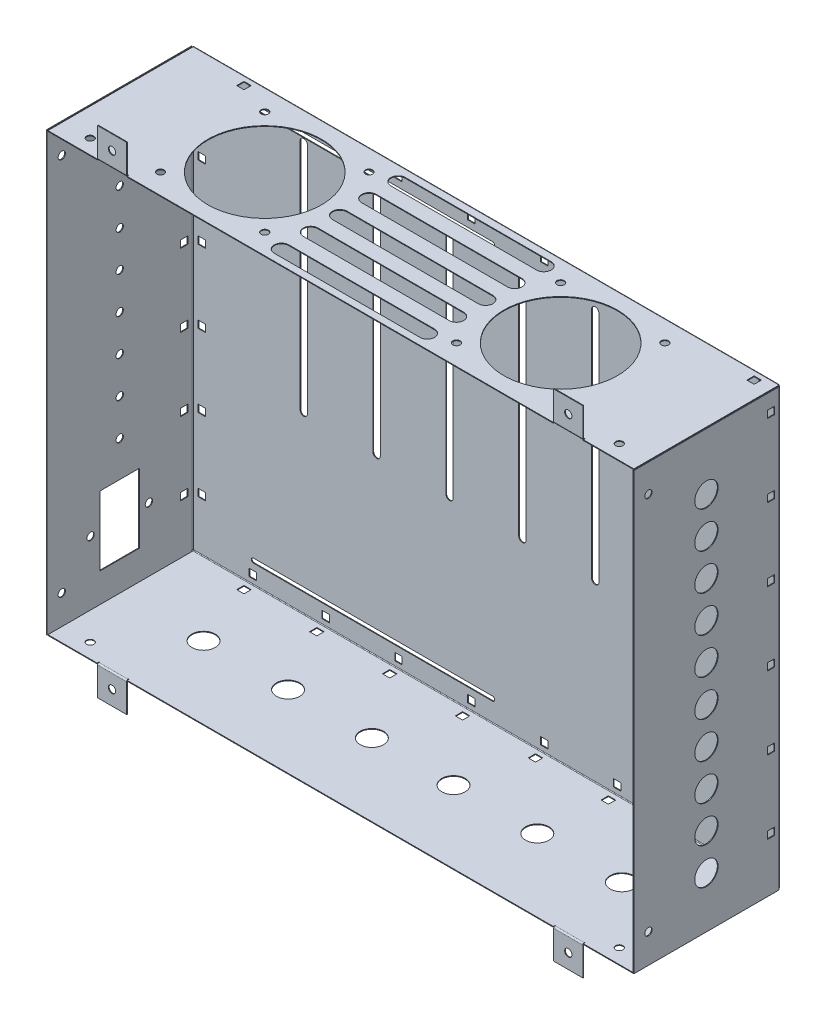
from build123d import *

# Parameters (mm, degrees)
SKETCH1_W                    = 403
SKETCH1_H                    = 300
BASE_FLANGE1_DEPTH           = 0.5
EDGE_FLANGE1_STRIP_W         = 3
EDGE_FLANGE1_STRIP_H         = 0.5
EDGE_FLANGE1_STRIP_CUT_DEPTH = 300
EDGE_FLANGE1_DEPTH           = 300
SKETCH11_R                   = 2.5
SKETCH11_R_2                 = 6.25
SKETCH11_W                   = 27
SKETCH11_H                   = 47.5
CUT_EXTRUDE1_DEPTH           = 10
EDGE_FLANGE2_START           = -202
EDGE_FLANGE2_DEPTH           = 403.5
EDGE_FLANGE2_2_DEPTH         = 1.5
EDGE_FLANGE2_START_2         = -200.5
EDGE_FLANGE2_3_DEPTH         = 402
EDGE_FLANGE3_START           = -150
EDGE_FLANGE3_DEPTH           = 301
EDGE_FLANGE3_START_2         = 149
EDGE_FLANGE3_2_DEPTH         = 2
EDGE_FLANGE3_3_DEPTH         = 299
EDGE_FLANGE4_START           = -202
EDGE_FLANGE4_DEPTH           = 404
EDGE_FLANGE4_2_DEPTH         = 1.5
EDGE_FLANGE4_START_2         = 200.5
EDGE_FLANGE4_3_DEPTH         = 1.5
EDGE_FLANGE4_START_3         = -200.5
EDGE_FLANGE4_4_DEPTH         = 401
SKETCH21_R                   = 2.5
SKETCH21_R_2                 = 39
CUT_EXTRUDE2_DEPTH           = 0.5
SKETCH28_R                   = 8
CUT_EXTRUDE3_DEPTH           = 0.5
SKETCH29_R                   = 8
CUT_EXTRUDE4_DEPTH           = 0.5
SKETCH30_R                   = 2.5
CUT_EXTRUDE5_DEPTH           = 10
CUT_EXTRUDE6_START           = -10
SKETCH31_R                   = 2.5
CUT_EXTRUDE6_DEPTH           = 10
SKETCH32_R                   = 2.5
CUT_EXTRUDE7_DEPTH           = 10
CUT_EXTRUDE8_START           = -10
SKETCH33_R                   = 2.5
CUT_EXTRUDE8_DEPTH           = 10
EDGE_FLANGE5_START           = 149
EDGE_FLANGE5_DEPTH           = 0.55137
EDGE_FLANGE5_START_2         = 149.5
EDGE_FLANGE5_2_DEPTH         = 1
EDGE_FLANGE5_START_3         = 150
EDGE_FLANGE5_3_OUTLINE_W     = 20
EDGE_FLANGE5_3_OUTLINE_H     = 0.5
EDGE_FLANGE5_3_DEPTH         = 20
EDGE_FLANGE5_START_4         = 146.5
EDGE_FLANGE5_4_DEPTH         = 20
EDGE_FLANGE5_5_DEPTH         = 20
EDGE_FLANGE5_START_5         = 99.5
EDGE_FLANGE5_6_OUTLINE_R     = 2.5
EDGE_FLANGE5_6_DEPTH         = 0.5
MIRROR2_START                = 149
MIRROR2_COPY_1_DEPTH         = 0.55137
MIRROR2_START_2              = 149.5
MIRROR2_COPY_2_DEPTH         = 1
MIRROR2_START_3              = 150
MIRROR2_COPY_3_SKETCH_W      = 20
MIRROR2_COPY_3_SKETCH_H      = 0.5
MIRROR2_COPY_3_DEPTH         = 20
MIRROR2_START_4              = 146.5
MIRROR2_COPY_4_DEPTH         = 20
MIRROR2_COPY_5_DEPTH         = 20
MIRROR2_START_5              = 99.5
MIRROR2_COPY_6_SKETCH_R      = 2.5
MIRROR2_COPY_6_DEPTH         = 0.5
MIRROR2_COPY_7_DEPTH         = 1
MIRROR2_COPY_8_SKETCH_W      = 20
MIRROR2_COPY_8_SKETCH_H      = 0.5
MIRROR2_COPY_8_DEPTH         = 20
MIRROR2_COPY_9_DEPTH         = 20
MIRROR2_COPY_10_DEPTH        = 20
MIRROR2_COPY_11_SKETCH_R     = 2.5
MIRROR2_COPY_11_DEPTH        = 0.5
CUT_EXTRUDE9_REACH           = 450.675
SKETCH37_W                   = 5
SKETCH37_H                   = 5
CUT_EXTRUDE10_REACH          = 284.139
SKETCH38_W                   = 5
SKETCH38_H                   = 5
CUT_EXTRUDE11_REACH          = 284.139
SKETCH39_W                   = 5
SKETCH39_H                   = 5
CUT_EXTRUDE12_REACH          = 393.155
SKETCH40_W                   = 5
SKETCH40_H                   = 5
CUT_EXTRUDE13_REACH          = 393.155
SKETCH41_W                   = 5
SKETCH41_H                   = 5
CUT_EXTRUDE15_DEPTH          = 10


with BuildPart() as part:
    # Base-Flange1: sheet metal written as solids
    # Sketch1 → Base-Flange1 (new body)
    with BuildSketch(Plane.XY):
        Rectangle(SKETCH1_W, SKETCH1_H)
        with BuildLine():
            Line((-27.5, -29.5), (-27.5, 130.5))
            ThreePointArc((-27.5, 130.5), (-25, 133), (-22.5, 130.5))
            Line((-22.5, 130.5), (-22.5, -29.5))
            ThreePointArc((-22.5, -29.5), (-25, -32), (-27.5, -29.5))
        make_face(mode=Mode.SUBTRACT)
        with BuildLine():
            Line((-77.5, -29.5), (-77.5, 130.5))
            ThreePointArc((-77.5, 130.5), (-75, 133), (-72.5, 130.5))
            Line((-72.5, 130.5), (-72.5, -29.5))
            ThreePointArc((-72.5, -29.5), (-75, -32), (-77.5, -29.5))
        make_face(mode=Mode.SUBTRACT)
        with BuildLine():
            Line((-127.5, -29.5), (-127.5, 130.5))
            ThreePointArc((-127.5, 130.5), (-125, 133), (-122.5, 130.5))
            Line((-122.5, 130.5), (-122.5, -29.5))
            ThreePointArc((-122.5, -29.5), (-125, -32), (-127.5, -29.5))
        make_face(mode=Mode.SUBTRACT)
        with BuildLine():
            Line((127.5, -29.5), (127.5, 130.5))
            ThreePointArc((127.5, 130.5), (125, 133), (122.5, 130.5))
            Line((122.5, 130.5), (122.5, -29.5))
            ThreePointArc((122.5, -29.5), (125, -32), (127.5, -29.5))
        make_face(mode=Mode.SUBTRACT)
        with BuildLine():
            Line((77.5, -29.5), (77.5, 130.5))
            ThreePointArc((77.5, 130.5), (75, 133), (72.5, 130.5))
            Line((72.5, 130.5), (72.5, -29.5))
            ThreePointArc((72.5, -29.5), (75, -32), (77.5, -29.5))
        make_face(mode=Mode.SUBTRACT)
        with BuildLine():
            Line((27.5, -29.5), (27.5, 130.5))
            ThreePointArc((27.5, 130.5), (25, 133), (22.5, 130.5))
            Line((22.5, 130.5), (22.5, -29.5))
            ThreePointArc((22.5, -29.5), (25, -32), (27.5, -29.5))
        make_face(mode=Mode.SUBTRACT)
    extrude(amount=-BASE_FLANGE1_DEPTH)

    # Edge-Flange1: sheet metal written as solids
    # Edge-Flange1 strip (on a plane across the edge) → Edge-Flange1 strip cut (cut)
    with BuildSketch(Plane(origin=(-201.5, 150, 0), x_dir=(1, 0, 0), z_dir=(0, -1, 0))):
        with Locations((-0.5, -0.25)):
            Rectangle(EDGE_FLANGE1_STRIP_W, EDGE_FLANGE1_STRIP_H)
    extrude(amount=EDGE_FLANGE1_STRIP_CUT_DEPTH, mode=Mode.SUBTRACT)

    # Edge-Flange1 section (on a plane across the edge) → Edge-Flange1 (add)
    with BuildSketch(Plane(origin=(-201.5, 150, 0), x_dir=(1, 0, 0), z_dir=(0, -1, 0))):
        with BuildLine():
            Line((0, 0.5), (0, 100))
            Line((0, 100), (0.5, 100))
            Line((0.5, 100), (0.5, 0.5))
            ThreePointArc((0.5, 0.5), (0.646446609, 0.146446609), (1, 0))
            Line((1, 0), (1, -0.5))
            ThreePointArc((1, -0.5), (0.292893219, -0.207106781), (0, 0.5))
        make_face()
    extrude(amount=EDGE_FLANGE1_DEPTH)

    # Sketch11 → Cut-Extrude1 (cut)
    with BuildSketch(Plane.ZY.offset(201.5)):
        with Locations((30.25, -106.25)):
            Circle(SKETCH11_R)
        with Locations((50.25, 92)):
            Circle(SKETCH11_R)
        with Locations((50.25, 122)):
            Circle(SKETCH11_R_2)
        with Locations((50.25, 67)):
            Circle(SKETCH11_R)
        with Locations((50.25, 42)):
            Circle(SKETCH11_R)
        with Locations((50.25, 17)):
            Circle(SKETCH11_R)
        with Locations((50.25, -8)):
            Circle(SKETCH11_R)
        with Locations((50.25, -33)):
            Circle(SKETCH11_R)
        with Locations((50.25, -58)):
            Circle(SKETCH11_R)
        with Locations(Location((70.25, -106.25, 0), (0, 0, 180))):
            Circle(SKETCH11_R)
        with Locations((50.25, -106.25)):
            Rectangle(SKETCH11_W, SKETCH11_H)
    extrude(amount=-CUT_EXTRUDE1_DEPTH, mode=Mode.SUBTRACT)

    # Edge-Flange2: read off the stored shape, not the designer's step
    # Edge-Flange2 outline → Edge-Flange2 (cut)
    with BuildSketch(Plane.YZ.offset(EDGE_FLANGE2_START)):
        with BuildLine():
            Line((149.5, 0.5), (149, 0.5))
            Line((149, 0.5), (149, 0))
            ThreePointArc((149, 0), (149.353553391, 0.146446609), (149.5, 0.5))
        make_face()
        with BuildLine():
            ThreePointArc((150, 0.5), (149.707106781, -0.207106781), (149, -0.5))
            Line((149, -0.5), (150, -0.5))
            Line((150, -0.5), (150, 0.5))
        make_face()
    extrude(amount=EDGE_FLANGE2_DEPTH, mode=Mode.SUBTRACT)

    # Edge-Flange2 2 outline → Edge-Flange2 2 (cut)
    with BuildSketch(Plane.YZ.offset(EDGE_FLANGE2_START)):
        with BuildLine():
            Line((150, 0.5), (149.5, 0.5))
            ThreePointArc((149.5, 0.5), (149.353553391, 0.146446609), (149, 0))
            Line((149, 0), (149, -0.5))
            ThreePointArc((149, -0.5), (149.707106781, -0.207106781), (150, 0.5))
        make_face()
    extrude(amount=EDGE_FLANGE2_2_DEPTH, mode=Mode.SUBTRACT)

    # Edge-Flange2 3 outline → Edge-Flange2 3 (add)
    with BuildSketch(Plane.YZ.offset(EDGE_FLANGE2_START_2)):
        with BuildLine():
            Line((149.5, 100), (149.5, 0.5))
            ThreePointArc((149.5, 0.5), (149.353553391, 0.146446609), (149, 0))
            Line((149, 0), (149.866025404, 0))
            ThreePointArc((149.866025404, 0), (149.965925826, 0.241180955), (150, 0.5))
            Line((150, 0.5), (150, 100))
            Line((150, 100), (149.5, 100))
        make_face()
    extrude(amount=EDGE_FLANGE2_3_DEPTH)

    # Edge-Flange3: read off the stored shape, not the designer's step
    # Edge-Flange3 outline → Edge-Flange3 (cut)
    with BuildSketch(Plane(origin=(0, 0, 0), x_dir=(1, 0, 0), z_dir=(0, 1, 0)).offset(EDGE_FLANGE3_START)):
        with BuildLine():
            Line((201.5, -0.5), (201.5, 0.5))
            Line((201.5, 0.5), (200.5, 0.5))
            ThreePointArc((200.5, 0.5), (201.207106781, 0.207106781), (201.5, -0.5))
        make_face()
        with BuildLine():
            Line((200.5, -0.5), (201, -0.5))
            ThreePointArc((201, -0.5), (200.853553391, -0.146446609), (200.5, 0))
            Line((200.5, 0), (200.5, -0.5))
        make_face()
    extrude(amount=EDGE_FLANGE3_DEPTH, mode=Mode.SUBTRACT)

    # Edge-Flange3 2 outline → Edge-Flange3 2 (cut)
    with BuildSketch(Plane(origin=(0, 0, 0), x_dir=(1, 0, 0), z_dir=(0, 1, 0)).offset(EDGE_FLANGE3_START_2)):
        with BuildLine():
            Line((201, -0.5), (201.5, -0.5))
            ThreePointArc((201.5, -0.5), (201.207106781, 0.207106781), (200.5, 0.5))
            Line((200.5, 0.5), (200.5, 0))
            ThreePointArc((200.5, 0), (200.853553391, -0.146446609), (201, -0.5))
        make_face()
    extrude(amount=EDGE_FLANGE3_2_DEPTH, mode=Mode.SUBTRACT)

    # Edge-Flange3 3 outline → Edge-Flange3 3 (add)
    with BuildSketch(Plane(origin=(0, 0, 0), x_dir=(1, 0, 0), z_dir=(0, 1, 0)).offset(EDGE_FLANGE3_START)):
        with BuildLine():
            Line((201.5, -100), (201.5, -0.5))
            ThreePointArc((201.5, -0.5), (201.465925826, -0.241180955), (201.366025404, 0))
            Line((201.366025404, 0), (200.5, 0))
            ThreePointArc((200.5, 0), (200.853553391, -0.146446609), (201, -0.5))
            Line((201, -0.5), (201, -100))
            Line((201, -100), (201.5, -100))
        make_face()
    extrude(amount=EDGE_FLANGE3_3_DEPTH)

    # Edge-Flange4: read off the stored shape, not the designer's step
    # Edge-Flange4 outline → Edge-Flange4 (cut)
    with BuildSketch(Plane.YZ.offset(EDGE_FLANGE4_START)):
        with BuildLine():
            Line((-150, 0.5), (-150, -0.5))
            Line((-150, -0.5), (-149, -0.5))
            ThreePointArc((-149, -0.5), (-149.707106781, -0.207106781), (-150, 0.5))
        make_face()
        with BuildLine():
            Line((-149, 0.5), (-149.5, 0.5))
            ThreePointArc((-149.5, 0.5), (-149.353553391, 0.146446609), (-149, 0))
            Line((-149, 0), (-149, 0.5))
        make_face()
    extrude(amount=EDGE_FLANGE4_DEPTH, mode=Mode.SUBTRACT)

    # Edge-Flange4 2 outline → Edge-Flange4 2 (cut)
    with BuildSketch(Plane.YZ.offset(EDGE_FLANGE4_START)):
        with BuildLine():
            Line((-149.5, 0.5), (-150, 0.5))
            ThreePointArc((-150, 0.5), (-149.707106781, -0.207106781), (-149, -0.5))
            Line((-149, -0.5), (-149, 0))
            ThreePointArc((-149, 0), (-149.353553391, 0.146446609), (-149.5, 0.5))
        make_face()
    extrude(amount=EDGE_FLANGE4_2_DEPTH, mode=Mode.SUBTRACT)

    # Edge-Flange4 3 outline → Edge-Flange4 3 (cut)
    with BuildSketch(Plane.YZ.offset(EDGE_FLANGE4_START_2)):
        with BuildLine():
            Line((-149.5, 0.5), (-150, 0.5))
            ThreePointArc((-150, 0.5), (-149.707106781, -0.207106781), (-149, -0.5))
            Line((-149, -0.5), (-149, 0))
            ThreePointArc((-149, 0), (-149.353553391, 0.146446609), (-149.5, 0.5))
        make_face()
    extrude(amount=EDGE_FLANGE4_3_DEPTH, mode=Mode.SUBTRACT)

    # Edge-Flange4 4 outline → Edge-Flange4 4 (add)
    with BuildSketch(Plane.YZ.offset(EDGE_FLANGE4_START_3)):
        with BuildLine():
            Line((-150, 100), (-150, 0.5))
            ThreePointArc((-150, 0.5), (-149.965925826, 0.241180955), (-149.866025404, 0))
            Line((-149.866025404, 0), (-149, 0))
            ThreePointArc((-149, 0), (-149.353553391, 0.146446609), (-149.5, 0.5))
            Line((-149.5, 0.5), (-149.5, 100))
            Line((-149.5, 100), (-150, 100))
        make_face()
    extrude(amount=EDGE_FLANGE4_4_DEPTH)

    # Sketch21 → Cut-Extrude2 (cut)
    with BuildSketch(Plane(origin=(0, 150, 0), x_dir=(1, 0, 0), z_dir=(0, 1, 0))):
        with Locations(Location((-65.75, -14.5, 0), (0, 0, 270))):
            Circle(SKETCH21_R)
        with Locations(Location((-65.75, -86, 0), (0, 0, 270))):
            Circle(SKETCH21_R)
        with Locations(Location((-137.25, -86, 0), (0, 0, 270))):
            Circle(SKETCH21_R)
        with Locations(Location((-137.25, -14.5, 0), (0, 0, 270))):
            Circle(SKETCH21_R)
        with Locations(Location((-101.5, -50.25, 0), (0, 0, 270))):
            Circle(SKETCH21_R_2)
        with Locations(Location((101.5, -50.25, 0), (0, 0, 90))):
            Circle(SKETCH21_R_2)
        with Locations(Location((137.25, -14.5, 0), (0, 0, 90))):
            Circle(SKETCH21_R)
        with Locations(Location((137.25, -86, 0), (0, 0, 90))):
            Circle(SKETCH21_R)
        with Locations(Location((65.75, -86, 0), (0, 0, 90))):
            Circle(SKETCH21_R)
        with Locations(Location((65.75, -14.5, 0), (0, 0, 90))):
            Circle(SKETCH21_R)
        with BuildLine():
            Line((-50, -45.25), (50, -45.25))
            ThreePointArc((50, -45.25), (55, -50.25), (50, -55.25))
            Line((50, -55.25), (-50, -55.25))
            ThreePointArc((-50, -55.25), (-55, -50.25), (-50, -45.25))
        make_face()
        with BuildLine():
            Line((-50, -25.25), (50, -25.25))
            ThreePointArc((50, -25.25), (55, -30.25), (50, -35.25))
            Line((50, -35.25), (-50, -35.25))
            ThreePointArc((-50, -35.25), (-55, -30.25), (-50, -25.25))
        make_face()
        with BuildLine():
            Line((-50, -5.25), (50, -5.25))
            ThreePointArc((50, -5.25), (55, -10.25), (50, -15.25))
            Line((50, -15.25), (-50, -15.25))
            ThreePointArc((-50, -15.25), (-55, -10.25), (-50, -5.25))
        make_face()
        with BuildLine():
            Line((-50, -75.25), (50, -75.25))
            ThreePointArc((50, -75.25), (55, -70.25), (50, -65.25))
            Line((50, -65.25), (-50, -65.25))
            ThreePointArc((-50, -65.25), (-55, -70.25), (-50, -75.25))
        make_face()
        with BuildLine():
            Line((-50, -95.25), (50, -95.25))
            ThreePointArc((50, -95.25), (55, -90.25), (50, -85.25))
            Line((50, -85.25), (-50, -85.25))
            ThreePointArc((-50, -85.25), (-55, -90.25), (-50, -95.25))
        make_face()
    extrude(amount=-CUT_EXTRUDE2_DEPTH, mode=Mode.SUBTRACT)

    # Sketch28 → Cut-Extrude3 (cut)
    with BuildSketch(Plane(origin=(201.5, 0, 0), x_dir=(0, 0, -1), z_dir=(1, 0, 0))):
        with Locations((-50.25, 110)):
            Circle(SKETCH28_R)
        with Locations((-50.25, 85)):
            Circle(SKETCH28_R)
        with Locations((-50.25, 60)):
            Circle(SKETCH28_R)
        with Locations((-50.25, 35)):
            Circle(SKETCH28_R)
        with Locations((-50.25, 10)):
            Circle(SKETCH28_R)
        with Locations((-50.25, -15)):
            Circle(SKETCH28_R)
        with Locations((-50.25, -40)):
            Circle(SKETCH28_R)
        with Locations((-50.25, -65)):
            Circle(SKETCH28_R)
        with Locations((-50.25, -90)):
            Circle(SKETCH28_R)
        with Locations((-50.25, -115)):
            Circle(SKETCH28_R)
    extrude(amount=-CUT_EXTRUDE3_DEPTH, mode=Mode.SUBTRACT)

    # Sketch29 → Cut-Extrude4 (cut)
    with BuildSketch(Plane.XZ.offset(150)):
        with Locations(Location((-143.5, 50.25, 0), (0, 0, 270))):
            Circle(SKETCH29_R)
        with Locations(Location((-85.5, 50.25, 0), (0, 0, 270))):
            Circle(SKETCH29_R)
        with Locations(Location((85.5, 50.25, 0), (0, 0, 90))):
            Circle(SKETCH29_R)
        with Locations(Location((143.5, 50.25, 0), (0, 0, 90))):
            Circle(SKETCH29_R)
        with Locations(Location((-28, 50.25, 0), (0, 0, 270))):
            Circle(SKETCH29_R)
        with Locations(Location((28, 50.25, 0), (0, 0, 90))):
            Circle(SKETCH29_R)
    extrude(amount=-CUT_EXTRUDE4_DEPTH, mode=Mode.SUBTRACT)

    # Sketch30 → Cut-Extrude5 (cut)
    with BuildSketch(Plane(origin=(201.5, 0, 0), x_dir=(0, 0, -1), z_dir=(1, 0, 0))):
        with Locations((-90, 129.99)):
            Circle(SKETCH30_R)
        with Locations(Location((-90, -129.99, 0), (0, 0, 180))):
            Circle(SKETCH30_R)
    extrude(amount=-CUT_EXTRUDE5_DEPTH, mode=Mode.SUBTRACT)

    # Sketch31 → Cut-Extrude6 (cut)
    with BuildSketch(Plane.ZY.offset(201.5).offset(CUT_EXTRUDE6_START)):
        with Locations(Location((90, 129.99, 0), (0, 0, 180))):
            Circle(SKETCH31_R)
        with Locations((90, -129.99)):
            Circle(SKETCH31_R)
    extrude(amount=CUT_EXTRUDE6_DEPTH, mode=Mode.SUBTRACT)

    # Sketch32 → Cut-Extrude7 (cut)
    with BuildSketch(Plane(origin=(0, 150, 0), x_dir=(1, 0, 0), z_dir=(0, 1, 0))):
        with Locations(Location((181.5, -90, 0), (0, 0, 270))):
            Circle(SKETCH32_R)
        with Locations(Location((-181.5, -90, 0), (0, 0, 90))):
            Circle(SKETCH32_R)
    extrude(amount=-CUT_EXTRUDE7_DEPTH, mode=Mode.SUBTRACT)

    # Sketch33 → Cut-Extrude8 (cut)
    with BuildSketch(Plane.XZ.offset(150).offset(CUT_EXTRUDE8_START)):
        with Locations(Location((-181.5, 90, 0), (0, 0, 270))):
            Circle(SKETCH33_R)
        with Locations(Location((181.5, 90, 0), (0, 0, 90))):
            Circle(SKETCH33_R)
    extrude(amount=CUT_EXTRUDE8_DEPTH, mode=Mode.SUBTRACT)

    # Edge-Flange5: read off the stored shape, not the designer's step
    # Edge-Flange5 outline → Edge-Flange5 (cut)
    with BuildSketch(Plane(origin=(0, 0, 0), x_dir=(1, 0, 0), z_dir=(0, 1, 0)).offset(EDGE_FLANGE5_START)):
        with BuildLine():
            Line((166.75, -100), (166.75, -98.75))
            ThreePointArc((166.75, -98.75), (166.625, -98.625), (166.5, -98.75))
            Line((166.5, -98.75), (166.5, -99.5))
            Line((166.5, -99.5), (146.5, -99.5))
            Line((146.5, -99.5), (146.5, -98.75))
            ThreePointArc((146.5, -98.75), (146.375, -98.625), (146.25, -98.75))
            Line((146.25, -98.75), (146.25, -100))
            Line((146.25, -100), (166.75, -100))
        make_face()
    edge_flange5 = extrude(amount=EDGE_FLANGE5_DEPTH, mode=Mode.SUBTRACT)

    # Edge-Flange5 2 outline → Edge-Flange5 2 (cut)
    with BuildSketch(Plane(origin=(0, 0, 0), x_dir=(1, 0, 0), z_dir=(0, 1, 0)).offset(EDGE_FLANGE5_START_2)):
        with BuildLine():
            Line((166.5, -98.75), (166.5, -100))
            Line((166.5, -100), (166.75, -100))
            Line((166.75, -100), (166.75, -98.75))
            ThreePointArc((166.75, -98.75), (166.625, -98.625), (166.5, -98.75))
        make_face()
        with BuildLine():
            Line((146.25, -100), (146.5, -100))
            Line((146.5, -100), (146.5, -98.75))
            ThreePointArc((146.5, -98.75), (146.375, -98.625), (146.25, -98.75))
            Line((146.25, -98.75), (146.25, -100))
        make_face()
    edge_flange5_2 = extrude(amount=EDGE_FLANGE5_2_DEPTH, mode=Mode.SUBTRACT)

    # Edge-Flange5 3 outline → Edge-Flange5 3 (add)
    with BuildSketch(Plane(origin=(0, 0, 0), x_dir=(1, 0, 0), z_dir=(0, 1, 0)).offset(EDGE_FLANGE5_START_3)):
        with Locations((156.5, -99.75)):
            Rectangle(EDGE_FLANGE5_3_OUTLINE_W, EDGE_FLANGE5_3_OUTLINE_H)
    edge_flange5_3 = extrude(amount=EDGE_FLANGE5_3_DEPTH)

    # Edge-Flange5 4 outline → Edge-Flange5 4 (add)
    with BuildSketch(Plane.YZ.offset(EDGE_FLANGE5_START_4)):
        with BuildLine():
            Line((150.5, 99.5), (150, 99.5))
            Line((150, 99.5), (150, 99))
            ThreePointArc((150, 99), (150.146446609, 99.353553391), (150.5, 99.5))
        make_face()
    edge_flange5_4 = extrude(amount=EDGE_FLANGE5_4_DEPTH)

    # Edge-Flange5 5 outline → Edge-Flange5 5 (cut)
    with BuildSketch(Plane.YZ.offset(EDGE_FLANGE5_START_4)):
        with BuildLine():
            Line((150.5, 100), (149.55137, 100))
            Line((149.55137, 100), (149.55137, 99.5))
            Line((149.55137, 99.5), (149.5, 99.5))
            Line((149.5, 99.5), (149.5, 99))
            ThreePointArc((149.5, 99), (149.792893219, 99.707106781), (150.5, 100))
        make_face()
    edge_flange5_5 = extrude(amount=EDGE_FLANGE5_5_DEPTH, mode=Mode.SUBTRACT)

    # Edge-Flange5 6 outline → Edge-Flange5 6 (cut)
    with BuildSketch(Plane.XY.offset(EDGE_FLANGE5_START_5)):
        with Locations((156.5, 160)):
            Circle(EDGE_FLANGE5_6_OUTLINE_R)
    edge_flange5_6 = extrude(amount=EDGE_FLANGE5_6_DEPTH, mode=Mode.SUBTRACT)

    # Mirror1: Edge-Flange5, Edge-Flange5 2, Edge-Flange5 3, Edge-Flange5 4, Edge-Flange5 5, Edge-Flange5 6 across plane
    add(edge_flange5.mirror(Plane(origin=(0, 0, 0), x_dir=(0, 0, 1), z_dir=(1, 0, 0))), mode=Mode.SUBTRACT)
    add(edge_flange5_2.mirror(Plane(origin=(0, 0, 0), x_dir=(0, 0, 1), z_dir=(1, 0, 0))), mode=Mode.SUBTRACT)
    add(edge_flange5_3.mirror(Plane(origin=(0, 0, 0), x_dir=(0, 0, 1), z_dir=(1, 0, 0))))
    add(edge_flange5_4.mirror(Plane(origin=(0, 0, 0), x_dir=(0, 0, 1), z_dir=(1, 0, 0))))
    add(edge_flange5_5.mirror(Plane(origin=(0, 0, 0), x_dir=(0, 0, 1), z_dir=(1, 0, 0))), mode=Mode.SUBTRACT)
    add(edge_flange5_6.mirror(Plane(origin=(0, 0, 0), x_dir=(0, 0, 1), z_dir=(1, 0, 0))), mode=Mode.SUBTRACT)

    # Mirror2: Edge-Flange5, Edge-Flange5 2, Edge-Flange5 3, Edge-Flange5 4, Edge-Flange5 5, Edge-Flange5 6 across plane
    add(edge_flange5.mirror(Plane.ZX), mode=Mode.SUBTRACT)
    add(edge_flange5_2.mirror(Plane.ZX), mode=Mode.SUBTRACT)
    add(edge_flange5_3.mirror(Plane.ZX))
    add(edge_flange5_4.mirror(Plane.ZX))
    add(edge_flange5_5.mirror(Plane.ZX), mode=Mode.SUBTRACT)
    add(edge_flange5_6.mirror(Plane.ZX), mode=Mode.SUBTRACT)

    # Mirror2 copy 1 sketch → Mirror2 copy 1 (cut)
    with BuildSketch(Plane(origin=(0, 0, 0), x_dir=(-1, 0, 0), z_dir=(0, -1, 0)).offset(MIRROR2_START)):
        with BuildLine():
            Line((166.75, -100), (166.75, -98.75))
            ThreePointArc((166.75, -98.75), (166.625, -98.625), (166.5, -98.75))
            Line((166.5, -98.75), (166.5, -99.5))
            Line((166.5, -99.5), (146.5, -99.5))
            Line((146.5, -99.5), (146.5, -98.75))
            ThreePointArc((146.5, -98.75), (146.375, -98.625), (146.25, -98.75))
            Line((146.25, -98.75), (146.25, -100))
            Line((146.25, -100), (166.75, -100))
        make_face()
    extrude(amount=MIRROR2_COPY_1_DEPTH, mode=Mode.SUBTRACT)

    # Mirror2 copy 2 sketch → Mirror2 copy 2 (cut)
    with BuildSketch(Plane(origin=(0, 0, 0), x_dir=(-1, 0, 0), z_dir=(0, -1, 0)).offset(MIRROR2_START_2)):
        with BuildLine():
            Line((166.5, -98.75), (166.5, -100))
            Line((166.5, -100), (166.75, -100))
            Line((166.75, -100), (166.75, -98.75))
            ThreePointArc((166.75, -98.75), (166.625, -98.625), (166.5, -98.75))
        make_face()
        with BuildLine():
            Line((146.25, -100), (146.5, -100))
            Line((146.5, -100), (146.5, -98.75))
            ThreePointArc((146.5, -98.75), (146.375, -98.625), (146.25, -98.75))
            Line((146.25, -98.75), (146.25, -100))
        make_face()
    extrude(amount=MIRROR2_COPY_2_DEPTH, mode=Mode.SUBTRACT)

    # Mirror2 copy 3 sketch → Mirror2 copy 3 (add)
    with BuildSketch(Plane(origin=(0, 0, 0), x_dir=(-1, 0, 0), z_dir=(0, -1, 0)).offset(MIRROR2_START_3)):
        with Locations((156.5, -99.75)):
            Rectangle(MIRROR2_COPY_3_SKETCH_W, MIRROR2_COPY_3_SKETCH_H)
    extrude(amount=MIRROR2_COPY_3_DEPTH)

    # Mirror2 copy 4 sketch → Mirror2 copy 4 (add)
    with BuildSketch(Plane(origin=(0, 0, 0), x_dir=(0, -1, 0), z_dir=(-1, 0, 0)).offset(MIRROR2_START_4)):
        with BuildLine():
            Line((150.5, 99.5), (150, 99.5))
            Line((150, 99.5), (150, 99))
            ThreePointArc((150, 99), (150.146446609, 99.353553391), (150.5, 99.5))
        make_face()
    extrude(amount=MIRROR2_COPY_4_DEPTH)

    # Mirror2 copy 5 sketch → Mirror2 copy 5 (cut)
    with BuildSketch(Plane(origin=(0, 0, 0), x_dir=(0, -1, 0), z_dir=(-1, 0, 0)).offset(MIRROR2_START_4)):
        with BuildLine():
            Line((150.5, 100), (149.55137, 100))
            Line((149.55137, 100), (149.55137, 99.5))
            Line((149.55137, 99.5), (149.5, 99.5))
            Line((149.5, 99.5), (149.5, 99))
            ThreePointArc((149.5, 99), (149.792893219, 99.707106781), (150.5, 100))
        make_face()
    extrude(amount=MIRROR2_COPY_5_DEPTH, mode=Mode.SUBTRACT)

    # Mirror2 copy 6 sketch → Mirror2 copy 6 (cut)
    with BuildSketch(Plane(origin=(0, 0, 0), x_dir=(-1, 0, 0), z_dir=(0, 0, 1)).offset(MIRROR2_START_5)):
        with Locations((156.5, 160)):
            Circle(MIRROR2_COPY_6_SKETCH_R)
    extrude(amount=MIRROR2_COPY_6_DEPTH, mode=Mode.SUBTRACT)

    # Mirror2 copy 7 sketch → Mirror2 copy 7 (cut)
    with BuildSketch(Plane.XZ.offset(MIRROR2_START_2)):
        with BuildLine():
            Line((166.5, 98.75), (166.5, 100))
            Line((166.5, 100), (166.75, 100))
            Line((166.75, 100), (166.75, 98.75))
            ThreePointArc((166.75, 98.75), (166.625, 98.625), (166.5, 98.75))
        make_face()
        with BuildLine():
            Line((146.25, 100), (146.5, 100))
            Line((146.5, 100), (146.5, 98.75))
            ThreePointArc((146.5, 98.75), (146.375, 98.625), (146.25, 98.75))
            Line((146.25, 98.75), (146.25, 100))
        make_face()
    extrude(amount=MIRROR2_COPY_7_DEPTH, mode=Mode.SUBTRACT)

    # Mirror2 copy 8 sketch → Mirror2 copy 8 (add)
    with BuildSketch(Plane.XZ.offset(MIRROR2_START_3)):
        with Locations((156.5, 99.75)):
            Rectangle(MIRROR2_COPY_8_SKETCH_W, MIRROR2_COPY_8_SKETCH_H)
    extrude(amount=MIRROR2_COPY_8_DEPTH)

    # Mirror2 copy 9 sketch → Mirror2 copy 9 (add)
    with BuildSketch(Plane(origin=(0, 0, 0), x_dir=(0, -1, 0), z_dir=(1, 0, 0)).offset(MIRROR2_START_4)):
        with BuildLine():
            Line((150.5, -99.5), (150, -99.5))
            Line((150, -99.5), (150, -99))
            ThreePointArc((150, -99), (150.146446609, -99.353553391), (150.5, -99.5))
        make_face()
    extrude(amount=MIRROR2_COPY_9_DEPTH)

    # Mirror2 copy 10 sketch → Mirror2 copy 10 (cut)
    with BuildSketch(Plane(origin=(0, 0, 0), x_dir=(0, -1, 0), z_dir=(1, 0, 0)).offset(MIRROR2_START_4)):
        with BuildLine():
            Line((150.5, -100), (149.55137, -100))
            Line((149.55137, -100), (149.55137, -99.5))
            Line((149.55137, -99.5), (149.5, -99.5))
            Line((149.5, -99.5), (149.5, -99))
            ThreePointArc((149.5, -99), (149.792893219, -99.707106781), (150.5, -100))
        make_face()
    extrude(amount=MIRROR2_COPY_10_DEPTH, mode=Mode.SUBTRACT)

    # Mirror2 copy 11 sketch → Mirror2 copy 11 (cut)
    with BuildSketch(Plane.XY.offset(MIRROR2_START_5)):
        with Locations((156.5, -160)):
            Circle(MIRROR2_COPY_11_SKETCH_R)
    extrude(amount=MIRROR2_COPY_11_DEPTH, mode=Mode.SUBTRACT)

    # Cut-Extrude9: up to this face of the body (flat: up to its plane)
    cut_extrude9_end = Plane(part.part.faces().sort_by_distance((-201.5, 4.361852208, 50.194702608))[0])
    # Sketch37 → Cut-Extrude9 (cut, up to the picked face)
    with BuildSketch(Plane(origin=(201.5, 0, 0), x_dir=(0, 0, -1), z_dir=(1, 0, 0)), mode=Mode.PRIVATE) as cut_extrude9_sk1:
        with Locations((-6, 136.5)):
            Rectangle(SKETCH37_W, SKETCH37_H)
    cut_extrude9_tool1 = split(extrude(cut_extrude9_sk1.sketch, amount=-CUT_EXTRUDE9_REACH, mode=Mode.PRIVATE), bisect_by=cut_extrude9_end, keep=Keep.BOTH, mode=Mode.PRIVATE)
    # Sketch37 → Cut-Extrude9 (cut, up to the picked face)
    with BuildSketch(Plane(origin=(201.5, 0, 0), x_dir=(0, 0, -1), z_dir=(1, 0, 0)), mode=Mode.PRIVATE) as cut_extrude9_sk2:
        with Locations((-6, 86.5)):
            Rectangle(SKETCH37_W, SKETCH37_H)
    cut_extrude9_tool2 = split(extrude(cut_extrude9_sk2.sketch, amount=-CUT_EXTRUDE9_REACH, mode=Mode.PRIVATE), bisect_by=cut_extrude9_end, keep=Keep.BOTH, mode=Mode.PRIVATE)
    # Sketch37 → Cut-Extrude9 (cut, up to the picked face)
    with BuildSketch(Plane(origin=(201.5, 0, 0), x_dir=(0, 0, -1), z_dir=(1, 0, 0)), mode=Mode.PRIVATE) as cut_extrude9_sk3:
        with Locations((-6, 36.5)):
            Rectangle(SKETCH37_W, SKETCH37_H)
    cut_extrude9_tool3 = split(extrude(cut_extrude9_sk3.sketch, amount=-CUT_EXTRUDE9_REACH, mode=Mode.PRIVATE), bisect_by=cut_extrude9_end, keep=Keep.BOTH, mode=Mode.PRIVATE)
    # Sketch37 → Cut-Extrude9 (cut, up to the picked face)
    with BuildSketch(Plane(origin=(201.5, 0, 0), x_dir=(0, 0, -1), z_dir=(1, 0, 0)), mode=Mode.PRIVATE) as cut_extrude9_sk4:
        with Locations((-6, -13.5)):
            Rectangle(SKETCH37_W, SKETCH37_H)
    cut_extrude9_tool4 = split(extrude(cut_extrude9_sk4.sketch, amount=-CUT_EXTRUDE9_REACH, mode=Mode.PRIVATE), bisect_by=cut_extrude9_end, keep=Keep.BOTH, mode=Mode.PRIVATE)
    # Sketch37 → Cut-Extrude9 (cut, up to the picked face)
    with BuildSketch(Plane(origin=(201.5, 0, 0), x_dir=(0, 0, -1), z_dir=(1, 0, 0)), mode=Mode.PRIVATE) as cut_extrude9_sk5:
        with Locations((-6, -63.5)):
            Rectangle(SKETCH37_W, SKETCH37_H)
    cut_extrude9_tool5 = split(extrude(cut_extrude9_sk5.sketch, amount=-CUT_EXTRUDE9_REACH, mode=Mode.PRIVATE), bisect_by=cut_extrude9_end, keep=Keep.BOTH, mode=Mode.PRIVATE)
    # Sketch37 → Cut-Extrude9 (cut, up to the picked face)
    with BuildSketch(Plane(origin=(201.5, 0, 0), x_dir=(0, 0, -1), z_dir=(1, 0, 0)), mode=Mode.PRIVATE) as cut_extrude9_sk6:
        with Locations((-6, -113.5)):
            Rectangle(SKETCH37_W, SKETCH37_H)
    cut_extrude9_tool6 = split(extrude(cut_extrude9_sk6.sketch, amount=-CUT_EXTRUDE9_REACH, mode=Mode.PRIVATE), bisect_by=cut_extrude9_end, keep=Keep.BOTH, mode=Mode.PRIVATE)
    add(cut_extrude9_tool1.solids().sort_by(Axis((201.5, 136.5, 6), (-1, 0, 0)))[0], mode=Mode.SUBTRACT)
    add(cut_extrude9_tool2.solids().sort_by(Axis((201.5, 86.5, 6), (-1, 0, 0)))[0], mode=Mode.SUBTRACT)
    add(cut_extrude9_tool3.solids().sort_by(Axis((201.5, 36.5, 6), (-1, 0, 0)))[0], mode=Mode.SUBTRACT)
    add(cut_extrude9_tool4.solids().sort_by(Axis((201.5, -13.5, 6), (-1, 0, 0)))[0], mode=Mode.SUBTRACT)
    add(cut_extrude9_tool5.solids().sort_by(Axis((201.5, -63.5, 6), (-1, 0, 0)))[0], mode=Mode.SUBTRACT)
    add(cut_extrude9_tool6.solids().sort_by(Axis((201.5, -113.5, 6), (-1, 0, 0)))[0], mode=Mode.SUBTRACT)

    # Sketch38 → Cut-Extrude10 (cut, up to next)
    with BuildSketch(Plane(origin=(0, 0, -0.5), x_dir=(-1, 0, 0), z_dir=(0, 0, -1)), mode=Mode.PRIVATE) as cut_extrude10_sk1:
        with Locations((195, 136.5)):
            Rectangle(SKETCH38_W, SKETCH38_H)
    cut_extrude10_tool1 = extrude(cut_extrude10_sk1.sketch, amount=-CUT_EXTRUDE10_REACH, mode=Mode.PRIVATE) & part.part
    # Sketch38 → Cut-Extrude10 (cut, up to next)
    with BuildSketch(Plane(origin=(0, 0, -0.5), x_dir=(-1, 0, 0), z_dir=(0, 0, -1)), mode=Mode.PRIVATE) as cut_extrude10_sk2:
        with Locations((195, 86.5)):
            Rectangle(SKETCH38_W, SKETCH38_H)
    cut_extrude10_tool2 = extrude(cut_extrude10_sk2.sketch, amount=-CUT_EXTRUDE10_REACH, mode=Mode.PRIVATE) & part.part
    # Sketch38 → Cut-Extrude10 (cut, up to next)
    with BuildSketch(Plane(origin=(0, 0, -0.5), x_dir=(-1, 0, 0), z_dir=(0, 0, -1)), mode=Mode.PRIVATE) as cut_extrude10_sk3:
        with Locations((195, 36.5)):
            Rectangle(SKETCH38_W, SKETCH38_H)
    cut_extrude10_tool3 = extrude(cut_extrude10_sk3.sketch, amount=-CUT_EXTRUDE10_REACH, mode=Mode.PRIVATE) & part.part
    # Sketch38 → Cut-Extrude10 (cut, up to next)
    with BuildSketch(Plane(origin=(0, 0, -0.5), x_dir=(-1, 0, 0), z_dir=(0, 0, -1)), mode=Mode.PRIVATE) as cut_extrude10_sk4:
        with Locations((195, -13.5)):
            Rectangle(SKETCH38_W, SKETCH38_H)
    cut_extrude10_tool4 = extrude(cut_extrude10_sk4.sketch, amount=-CUT_EXTRUDE10_REACH, mode=Mode.PRIVATE) & part.part
    # Sketch38 → Cut-Extrude10 (cut, up to next)
    with BuildSketch(Plane(origin=(0, 0, -0.5), x_dir=(-1, 0, 0), z_dir=(0, 0, -1)), mode=Mode.PRIVATE) as cut_extrude10_sk5:
        with Locations((195, -63.5)):
            Rectangle(SKETCH38_W, SKETCH38_H)
    cut_extrude10_tool5 = extrude(cut_extrude10_sk5.sketch, amount=-CUT_EXTRUDE10_REACH, mode=Mode.PRIVATE) & part.part
    # Sketch38 → Cut-Extrude10 (cut, up to next)
    with BuildSketch(Plane(origin=(0, 0, -0.5), x_dir=(-1, 0, 0), z_dir=(0, 0, -1)), mode=Mode.PRIVATE) as cut_extrude10_sk6:
        with Locations((195, -113.5)):
            Rectangle(SKETCH38_W, SKETCH38_H)
    cut_extrude10_tool6 = extrude(cut_extrude10_sk6.sketch, amount=-CUT_EXTRUDE10_REACH, mode=Mode.PRIVATE) & part.part
    # Sketch38 → Cut-Extrude10 (cut, up to next)
    with BuildSketch(Plane(origin=(0, 0, -0.5), x_dir=(-1, 0, 0), z_dir=(0, 0, -1)), mode=Mode.PRIVATE) as cut_extrude10_sk7:
        with Locations((-195, -113.5)):
            Rectangle(SKETCH38_W, SKETCH38_H)
    cut_extrude10_tool7 = extrude(cut_extrude10_sk7.sketch, amount=-CUT_EXTRUDE10_REACH, mode=Mode.PRIVATE) & part.part
    # Sketch38 → Cut-Extrude10 (cut, up to next)
    with BuildSketch(Plane(origin=(0, 0, -0.5), x_dir=(-1, 0, 0), z_dir=(0, 0, -1)), mode=Mode.PRIVATE) as cut_extrude10_sk8:
        with Locations((-195, -63.5)):
            Rectangle(SKETCH38_W, SKETCH38_H)
    cut_extrude10_tool8 = extrude(cut_extrude10_sk8.sketch, amount=-CUT_EXTRUDE10_REACH, mode=Mode.PRIVATE) & part.part
    # Sketch38 → Cut-Extrude10 (cut, up to next)
    with BuildSketch(Plane(origin=(0, 0, -0.5), x_dir=(-1, 0, 0), z_dir=(0, 0, -1)), mode=Mode.PRIVATE) as cut_extrude10_sk9:
        with Locations((-195, -13.5)):
            Rectangle(SKETCH38_W, SKETCH38_H)
    cut_extrude10_tool9 = extrude(cut_extrude10_sk9.sketch, amount=-CUT_EXTRUDE10_REACH, mode=Mode.PRIVATE) & part.part
    # Sketch38 → Cut-Extrude10 (cut, up to next)
    with BuildSketch(Plane(origin=(0, 0, -0.5), x_dir=(-1, 0, 0), z_dir=(0, 0, -1)), mode=Mode.PRIVATE) as cut_extrude10_sk10:
        with Locations((-195, 36.5)):
            Rectangle(SKETCH38_W, SKETCH38_H)
    cut_extrude10_tool10 = extrude(cut_extrude10_sk10.sketch, amount=-CUT_EXTRUDE10_REACH, mode=Mode.PRIVATE) & part.part
    # Sketch38 → Cut-Extrude10 (cut, up to next)
    with BuildSketch(Plane(origin=(0, 0, -0.5), x_dir=(-1, 0, 0), z_dir=(0, 0, -1)), mode=Mode.PRIVATE) as cut_extrude10_sk11:
        with Locations((-195, 86.5)):
            Rectangle(SKETCH38_W, SKETCH38_H)
    cut_extrude10_tool11 = extrude(cut_extrude10_sk11.sketch, amount=-CUT_EXTRUDE10_REACH, mode=Mode.PRIVATE) & part.part
    # Sketch38 → Cut-Extrude10 (cut, up to next)
    with BuildSketch(Plane(origin=(0, 0, -0.5), x_dir=(-1, 0, 0), z_dir=(0, 0, -1)), mode=Mode.PRIVATE) as cut_extrude10_sk12:
        with Locations((-195, 136.5)):
            Rectangle(SKETCH38_W, SKETCH38_H)
    cut_extrude10_tool12 = extrude(cut_extrude10_sk12.sketch, amount=-CUT_EXTRUDE10_REACH, mode=Mode.PRIVATE) & part.part
    add(cut_extrude10_tool1.solids().sort_by_distance((-195, 136.5, -0.5))[0], mode=Mode.SUBTRACT)
    add(cut_extrude10_tool2.solids().sort_by_distance((-195, 86.5, -0.5))[0], mode=Mode.SUBTRACT)
    add(cut_extrude10_tool3.solids().sort_by_distance((-195, 36.5, -0.5))[0], mode=Mode.SUBTRACT)
    add(cut_extrude10_tool4.solids().sort_by_distance((-195, -13.5, -0.5))[0], mode=Mode.SUBTRACT)
    add(cut_extrude10_tool5.solids().sort_by_distance((-195, -63.5, -0.5))[0], mode=Mode.SUBTRACT)
    add(cut_extrude10_tool6.solids().sort_by_distance((-195, -113.5, -0.5))[0], mode=Mode.SUBTRACT)
    add(cut_extrude10_tool7.solids().sort_by_distance((195, -113.5, -0.5))[0], mode=Mode.SUBTRACT)
    add(cut_extrude10_tool8.solids().sort_by_distance((195, -63.5, -0.5))[0], mode=Mode.SUBTRACT)
    add(cut_extrude10_tool9.solids().sort_by_distance((195, -13.5, -0.5))[0], mode=Mode.SUBTRACT)
    add(cut_extrude10_tool10.solids().sort_by_distance((195, 36.5, -0.5))[0], mode=Mode.SUBTRACT)
    add(cut_extrude10_tool11.solids().sort_by_distance((195, 86.5, -0.5))[0], mode=Mode.SUBTRACT)
    add(cut_extrude10_tool12.solids().sort_by_distance((195, 136.5, -0.5))[0], mode=Mode.SUBTRACT)

    # Sketch39 → Cut-Extrude11 (cut, up to next)
    with BuildSketch(Plane(origin=(0, 0, -0.5), x_dir=(-1, 0, 0), z_dir=(0, 0, -1)), mode=Mode.PRIVATE) as cut_extrude11_sk1:
        with Locations((-190, -143.5)):
            Rectangle(SKETCH39_W, SKETCH39_H)
    cut_extrude11_tool1 = extrude(cut_extrude11_sk1.sketch, amount=-CUT_EXTRUDE11_REACH, mode=Mode.PRIVATE) & part.part
    # Sketch39 → Cut-Extrude11 (cut, up to next)
    with BuildSketch(Plane(origin=(0, 0, -0.5), x_dir=(-1, 0, 0), z_dir=(0, 0, -1)), mode=Mode.PRIVATE) as cut_extrude11_sk2:
        with Locations((-140, -143.5)):
            Rectangle(SKETCH39_W, SKETCH39_H)
    cut_extrude11_tool2 = extrude(cut_extrude11_sk2.sketch, amount=-CUT_EXTRUDE11_REACH, mode=Mode.PRIVATE) & part.part
    # Sketch39 → Cut-Extrude11 (cut, up to next)
    with BuildSketch(Plane(origin=(0, 0, -0.5), x_dir=(-1, 0, 0), z_dir=(0, 0, -1)), mode=Mode.PRIVATE) as cut_extrude11_sk3:
        with Locations((-90, -143.5)):
            Rectangle(SKETCH39_W, SKETCH39_H)
    cut_extrude11_tool3 = extrude(cut_extrude11_sk3.sketch, amount=-CUT_EXTRUDE11_REACH, mode=Mode.PRIVATE) & part.part
    # Sketch39 → Cut-Extrude11 (cut, up to next)
    with BuildSketch(Plane(origin=(0, 0, -0.5), x_dir=(-1, 0, 0), z_dir=(0, 0, -1)), mode=Mode.PRIVATE) as cut_extrude11_sk4:
        with Locations((-40, -143.5)):
            Rectangle(SKETCH39_W, SKETCH39_H)
    cut_extrude11_tool4 = extrude(cut_extrude11_sk4.sketch, amount=-CUT_EXTRUDE11_REACH, mode=Mode.PRIVATE) & part.part
    # Sketch39 → Cut-Extrude11 (cut, up to next)
    with BuildSketch(Plane(origin=(0, 0, -0.5), x_dir=(-1, 0, 0), z_dir=(0, 0, -1)), mode=Mode.PRIVATE) as cut_extrude11_sk5:
        with Locations((10, -143.5)):
            Rectangle(SKETCH39_W, SKETCH39_H)
    cut_extrude11_tool5 = extrude(cut_extrude11_sk5.sketch, amount=-CUT_EXTRUDE11_REACH, mode=Mode.PRIVATE) & part.part
    # Sketch39 → Cut-Extrude11 (cut, up to next)
    with BuildSketch(Plane(origin=(0, 0, -0.5), x_dir=(-1, 0, 0), z_dir=(0, 0, -1)), mode=Mode.PRIVATE) as cut_extrude11_sk6:
        with Locations((60, -143.5)):
            Rectangle(SKETCH39_W, SKETCH39_H)
    cut_extrude11_tool6 = extrude(cut_extrude11_sk6.sketch, amount=-CUT_EXTRUDE11_REACH, mode=Mode.PRIVATE) & part.part
    # Sketch39 → Cut-Extrude11 (cut, up to next)
    with BuildSketch(Plane(origin=(0, 0, -0.5), x_dir=(-1, 0, 0), z_dir=(0, 0, -1)), mode=Mode.PRIVATE) as cut_extrude11_sk7:
        with Locations((110, -143.5)):
            Rectangle(SKETCH39_W, SKETCH39_H)
    cut_extrude11_tool7 = extrude(cut_extrude11_sk7.sketch, amount=-CUT_EXTRUDE11_REACH, mode=Mode.PRIVATE) & part.part
    # Sketch39 → Cut-Extrude11 (cut, up to next)
    with BuildSketch(Plane(origin=(0, 0, -0.5), x_dir=(-1, 0, 0), z_dir=(0, 0, -1)), mode=Mode.PRIVATE) as cut_extrude11_sk8:
        with Locations((160, -143.5)):
            Rectangle(SKETCH39_W, SKETCH39_H)
    cut_extrude11_tool8 = extrude(cut_extrude11_sk8.sketch, amount=-CUT_EXTRUDE11_REACH, mode=Mode.PRIVATE) & part.part
    # Sketch39 → Cut-Extrude11 (cut, up to next)
    with BuildSketch(Plane(origin=(0, 0, -0.5), x_dir=(-1, 0, 0), z_dir=(0, 0, -1)), mode=Mode.PRIVATE) as cut_extrude11_sk9:
        with Locations((160, 143.5)):
            Rectangle(SKETCH39_W, SKETCH39_H)
    cut_extrude11_tool9 = extrude(cut_extrude11_sk9.sketch, amount=-CUT_EXTRUDE11_REACH, mode=Mode.PRIVATE) & part.part
    # Sketch39 → Cut-Extrude11 (cut, up to next)
    with BuildSketch(Plane(origin=(0, 0, -0.5), x_dir=(-1, 0, 0), z_dir=(0, 0, -1)), mode=Mode.PRIVATE) as cut_extrude11_sk10:
        with Locations((110, 143.5)):
            Rectangle(SKETCH39_W, SKETCH39_H)
    cut_extrude11_tool10 = extrude(cut_extrude11_sk10.sketch, amount=-CUT_EXTRUDE11_REACH, mode=Mode.PRIVATE) & part.part
    # Sketch39 → Cut-Extrude11 (cut, up to next)
    with BuildSketch(Plane(origin=(0, 0, -0.5), x_dir=(-1, 0, 0), z_dir=(0, 0, -1)), mode=Mode.PRIVATE) as cut_extrude11_sk11:
        with Locations((60, 143.5)):
            Rectangle(SKETCH39_W, SKETCH39_H)
    cut_extrude11_tool11 = extrude(cut_extrude11_sk11.sketch, amount=-CUT_EXTRUDE11_REACH, mode=Mode.PRIVATE) & part.part
    # Sketch39 → Cut-Extrude11 (cut, up to next)
    with BuildSketch(Plane(origin=(0, 0, -0.5), x_dir=(-1, 0, 0), z_dir=(0, 0, -1)), mode=Mode.PRIVATE) as cut_extrude11_sk12:
        with Locations((10, 143.5)):
            Rectangle(SKETCH39_W, SKETCH39_H)
    cut_extrude11_tool12 = extrude(cut_extrude11_sk12.sketch, amount=-CUT_EXTRUDE11_REACH, mode=Mode.PRIVATE) & part.part
    # Sketch39 → Cut-Extrude11 (cut, up to next)
    with BuildSketch(Plane(origin=(0, 0, -0.5), x_dir=(-1, 0, 0), z_dir=(0, 0, -1)), mode=Mode.PRIVATE) as cut_extrude11_sk13:
        with Locations((-40, 143.5)):
            Rectangle(SKETCH39_W, SKETCH39_H)
    cut_extrude11_tool13 = extrude(cut_extrude11_sk13.sketch, amount=-CUT_EXTRUDE11_REACH, mode=Mode.PRIVATE) & part.part
    # Sketch39 → Cut-Extrude11 (cut, up to next)
    with BuildSketch(Plane(origin=(0, 0, -0.5), x_dir=(-1, 0, 0), z_dir=(0, 0, -1)), mode=Mode.PRIVATE) as cut_extrude11_sk14:
        with Locations((-90, 143.5)):
            Rectangle(SKETCH39_W, SKETCH39_H)
    cut_extrude11_tool14 = extrude(cut_extrude11_sk14.sketch, amount=-CUT_EXTRUDE11_REACH, mode=Mode.PRIVATE) & part.part
    # Sketch39 → Cut-Extrude11 (cut, up to next)
    with BuildSketch(Plane(origin=(0, 0, -0.5), x_dir=(-1, 0, 0), z_dir=(0, 0, -1)), mode=Mode.PRIVATE) as cut_extrude11_sk15:
        with Locations((-140, 143.5)):
            Rectangle(SKETCH39_W, SKETCH39_H)
    cut_extrude11_tool15 = extrude(cut_extrude11_sk15.sketch, amount=-CUT_EXTRUDE11_REACH, mode=Mode.PRIVATE) & part.part
    # Sketch39 → Cut-Extrude11 (cut, up to next)
    with BuildSketch(Plane(origin=(0, 0, -0.5), x_dir=(-1, 0, 0), z_dir=(0, 0, -1)), mode=Mode.PRIVATE) as cut_extrude11_sk16:
        with Locations((-190, 143.5)):
            Rectangle(SKETCH39_W, SKETCH39_H)
    cut_extrude11_tool16 = extrude(cut_extrude11_sk16.sketch, amount=-CUT_EXTRUDE11_REACH, mode=Mode.PRIVATE) & part.part
    add(cut_extrude11_tool1.solids().sort_by_distance((190, -143.5, -0.5))[0], mode=Mode.SUBTRACT)
    add(cut_extrude11_tool2.solids().sort_by_distance((140, -143.5, -0.5))[0], mode=Mode.SUBTRACT)
    add(cut_extrude11_tool3.solids().sort_by_distance((90, -143.5, -0.5))[0], mode=Mode.SUBTRACT)
    add(cut_extrude11_tool4.solids().sort_by_distance((40, -143.5, -0.5))[0], mode=Mode.SUBTRACT)
    add(cut_extrude11_tool5.solids().sort_by_distance((-10, -143.5, -0.5))[0], mode=Mode.SUBTRACT)
    add(cut_extrude11_tool6.solids().sort_by_distance((-60, -143.5, -0.5))[0], mode=Mode.SUBTRACT)
    add(cut_extrude11_tool7.solids().sort_by_distance((-110, -143.5, -0.5))[0], mode=Mode.SUBTRACT)
    add(cut_extrude11_tool8.solids().sort_by_distance((-160, -143.5, -0.5))[0], mode=Mode.SUBTRACT)
    add(cut_extrude11_tool9.solids().sort_by_distance((-160, 143.5, -0.5))[0], mode=Mode.SUBTRACT)
    add(cut_extrude11_tool10.solids().sort_by_distance((-110, 143.5, -0.5))[0], mode=Mode.SUBTRACT)
    add(cut_extrude11_tool11.solids().sort_by_distance((-60, 143.5, -0.5))[0], mode=Mode.SUBTRACT)
    add(cut_extrude11_tool12.solids().sort_by_distance((-10, 143.5, -0.5))[0], mode=Mode.SUBTRACT)
    add(cut_extrude11_tool13.solids().sort_by_distance((40, 143.5, -0.5))[0], mode=Mode.SUBTRACT)
    add(cut_extrude11_tool14.solids().sort_by_distance((90, 143.5, -0.5))[0], mode=Mode.SUBTRACT)
    add(cut_extrude11_tool15.solids().sort_by_distance((140, 143.5, -0.5))[0], mode=Mode.SUBTRACT)
    add(cut_extrude11_tool16.solids().sort_by_distance((190, 143.5, -0.5))[0], mode=Mode.SUBTRACT)

    # Sketch40 → Cut-Extrude12 (cut, up to next)
    with BuildSketch(Plane(origin=(0, 150, 0), x_dir=(1, 0, 0), z_dir=(0, 1, 0)), mode=Mode.PRIVATE) as cut_extrude12_sk1:
        with Locations((190, -6)):
            Rectangle(SKETCH40_W, SKETCH40_H)
    cut_extrude12_tool1 = extrude(cut_extrude12_sk1.sketch, amount=-CUT_EXTRUDE12_REACH, mode=Mode.PRIVATE) & part.part
    # Sketch40 → Cut-Extrude12 (cut, up to next)
    with BuildSketch(Plane(origin=(0, 150, 0), x_dir=(1, 0, 0), z_dir=(0, 1, 0)), mode=Mode.PRIVATE) as cut_extrude12_sk2:
        with Locations((-160, -6)):
            Rectangle(SKETCH40_W, SKETCH40_H)
    cut_extrude12_tool2 = extrude(cut_extrude12_sk2.sketch, amount=-CUT_EXTRUDE12_REACH, mode=Mode.PRIVATE) & part.part
    add(cut_extrude12_tool1.solids().sort_by_distance((190, 150, 6))[0], mode=Mode.SUBTRACT)
    add(cut_extrude12_tool2.solids().sort_by_distance((-160, 150, 6))[0], mode=Mode.SUBTRACT)

    # Sketch41 → Cut-Extrude13 (cut, up to next)
    with BuildSketch(Plane(origin=(0, -150, 0), x_dir=(-1, 0, 0), z_dir=(0, -1, 0)), mode=Mode.PRIVATE) as cut_extrude13_sk1:
        with Locations((-190, -6)):
            Rectangle(SKETCH41_W, SKETCH41_H)
    cut_extrude13_tool1 = extrude(cut_extrude13_sk1.sketch, amount=-CUT_EXTRUDE13_REACH, mode=Mode.PRIVATE) & part.part
    # Sketch41 → Cut-Extrude13 (cut, up to next)
    with BuildSketch(Plane(origin=(0, -150, 0), x_dir=(-1, 0, 0), z_dir=(0, -1, 0)), mode=Mode.PRIVATE) as cut_extrude13_sk2:
        with Locations((-140, -6)):
            Rectangle(SKETCH41_W, SKETCH41_H)
    cut_extrude13_tool2 = extrude(cut_extrude13_sk2.sketch, amount=-CUT_EXTRUDE13_REACH, mode=Mode.PRIVATE) & part.part
    # Sketch41 → Cut-Extrude13 (cut, up to next)
    with BuildSketch(Plane(origin=(0, -150, 0), x_dir=(-1, 0, 0), z_dir=(0, -1, 0)), mode=Mode.PRIVATE) as cut_extrude13_sk3:
        with Locations((-90, -6)):
            Rectangle(SKETCH41_W, SKETCH41_H)
    cut_extrude13_tool3 = extrude(cut_extrude13_sk3.sketch, amount=-CUT_EXTRUDE13_REACH, mode=Mode.PRIVATE) & part.part
    # Sketch41 → Cut-Extrude13 (cut, up to next)
    with BuildSketch(Plane(origin=(0, -150, 0), x_dir=(-1, 0, 0), z_dir=(0, -1, 0)), mode=Mode.PRIVATE) as cut_extrude13_sk4:
        with Locations((-40, -6)):
            Rectangle(SKETCH41_W, SKETCH41_H)
    cut_extrude13_tool4 = extrude(cut_extrude13_sk4.sketch, amount=-CUT_EXTRUDE13_REACH, mode=Mode.PRIVATE) & part.part
    # Sketch41 → Cut-Extrude13 (cut, up to next)
    with BuildSketch(Plane(origin=(0, -150, 0), x_dir=(-1, 0, 0), z_dir=(0, -1, 0)), mode=Mode.PRIVATE) as cut_extrude13_sk5:
        with Locations((10, -6)):
            Rectangle(SKETCH41_W, SKETCH41_H)
    cut_extrude13_tool5 = extrude(cut_extrude13_sk5.sketch, amount=-CUT_EXTRUDE13_REACH, mode=Mode.PRIVATE) & part.part
    # Sketch41 → Cut-Extrude13 (cut, up to next)
    with BuildSketch(Plane(origin=(0, -150, 0), x_dir=(-1, 0, 0), z_dir=(0, -1, 0)), mode=Mode.PRIVATE) as cut_extrude13_sk6:
        with Locations((60, -6)):
            Rectangle(SKETCH41_W, SKETCH41_H)
    cut_extrude13_tool6 = extrude(cut_extrude13_sk6.sketch, amount=-CUT_EXTRUDE13_REACH, mode=Mode.PRIVATE) & part.part
    # Sketch41 → Cut-Extrude13 (cut, up to next)
    with BuildSketch(Plane(origin=(0, -150, 0), x_dir=(-1, 0, 0), z_dir=(0, -1, 0)), mode=Mode.PRIVATE) as cut_extrude13_sk7:
        with Locations((110, -6)):
            Rectangle(SKETCH41_W, SKETCH41_H)
    cut_extrude13_tool7 = extrude(cut_extrude13_sk7.sketch, amount=-CUT_EXTRUDE13_REACH, mode=Mode.PRIVATE) & part.part
    # Sketch41 → Cut-Extrude13 (cut, up to next)
    with BuildSketch(Plane(origin=(0, -150, 0), x_dir=(-1, 0, 0), z_dir=(0, -1, 0)), mode=Mode.PRIVATE) as cut_extrude13_sk8:
        with Locations((160, -6)):
            Rectangle(SKETCH41_W, SKETCH41_H)
    cut_extrude13_tool8 = extrude(cut_extrude13_sk8.sketch, amount=-CUT_EXTRUDE13_REACH, mode=Mode.PRIVATE) & part.part
    add(cut_extrude13_tool1.solids().sort_by_distance((190, -150, 6))[0], mode=Mode.SUBTRACT)
    add(cut_extrude13_tool2.solids().sort_by_distance((140, -150, 6))[0], mode=Mode.SUBTRACT)
    add(cut_extrude13_tool3.solids().sort_by_distance((90, -150, 6))[0], mode=Mode.SUBTRACT)
    add(cut_extrude13_tool4.solids().sort_by_distance((40, -150, 6))[0], mode=Mode.SUBTRACT)
    add(cut_extrude13_tool5.solids().sort_by_distance((-10, -150, 6))[0], mode=Mode.SUBTRACT)
    add(cut_extrude13_tool6.solids().sort_by_distance((-60, -150, 6))[0], mode=Mode.SUBTRACT)
    add(cut_extrude13_tool7.solids().sort_by_distance((-110, -150, 6))[0], mode=Mode.SUBTRACT)
    add(cut_extrude13_tool8.solids().sort_by_distance((-160, -150, 6))[0], mode=Mode.SUBTRACT)

    # Sketch43 → Cut-Extrude15 (cut)
    with BuildSketch(Plane(origin=(0, 0, -0.5), x_dir=(-1, 0, 0), z_dir=(0, 0, -1))):
        with BuildLine():
            Line((159.5, 133.5), (-4.5, 133.5))
            ThreePointArc((-4.5, 133.5), (-6, 135), (-4.5, 136.5))
            Line((-4.5, 136.5), (159.5, 136.5))
            ThreePointArc((159.5, 136.5), (161, 135), (159.5, 133.5))
        make_face()
        with BuildLine():
            Line((159.5, -133.5), (-4.5, -133.5))
            ThreePointArc((-4.5, -133.5), (-6, -135), (-4.5, -136.5))
            Line((-4.5, -136.5), (159.5, -136.5))
            ThreePointArc((159.5, -136.5), (161, -135), (159.5, -133.5))
        make_face()
    extrude(amount=-CUT_EXTRUDE15_DEPTH, mode=Mode.SUBTRACT)


solid = part.part
